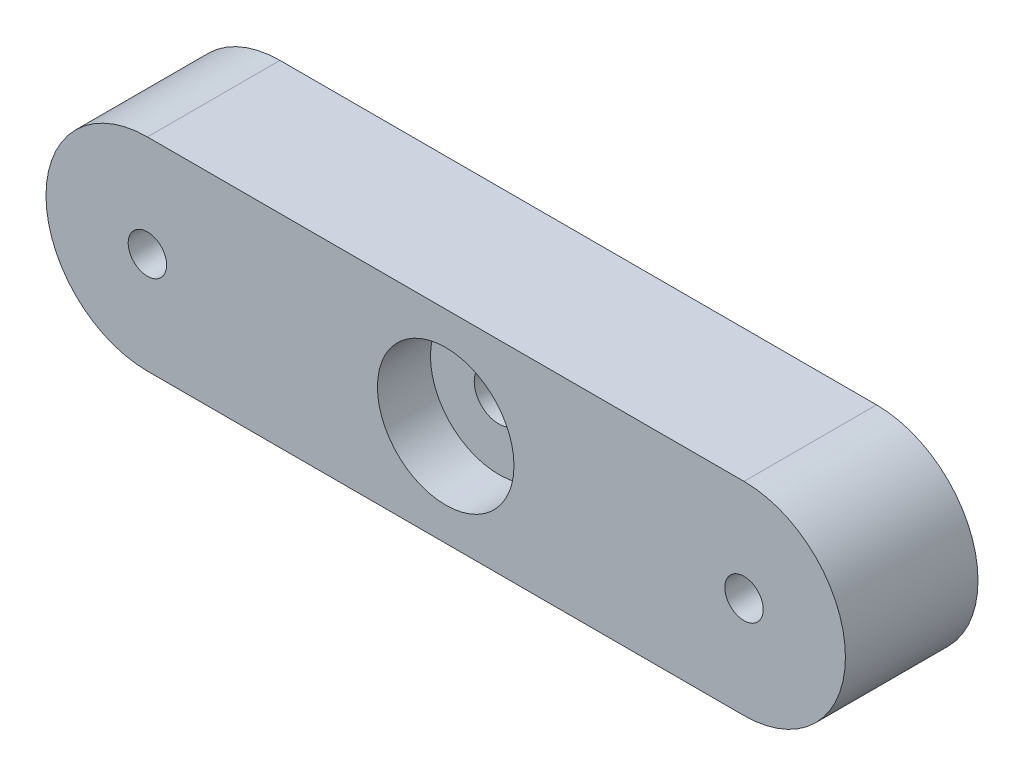
from build123d import *

# Parameters (mm, degrees)
SKETCH_1_R      = 1.45
SKETCH_1_R_2    = 5.15
EXTRUDE_1_DEPTH = 10
SKETCH_2_R      = 5.305373799
SKETCH_2_R_2    = 1.85
EXTRUDE_2_DEPTH = 6


with BuildPart() as part:
    # Эскиз1 → Бобышка-Вытянуть1 (new body)
    with BuildSketch(Plane.XY):
        with BuildLine():
            Line((0, 7.65), (45, 7.65))
            ThreePointArc((45, 7.65), (52.65, 0), (45, -7.65))
            Line((45, -7.65), (0, -7.65))
            ThreePointArc((0, -7.65), (-7.65, 0), (0, 7.65))
        make_face()
        Circle(SKETCH_1_R, mode=Mode.SUBTRACT)
        with Locations((45, 0)):
            Circle(SKETCH_1_R, mode=Mode.SUBTRACT)
        with Locations((22.5, 0)):
            Circle(SKETCH_1_R_2, mode=Mode.SUBTRACT)
    extrude(amount=EXTRUDE_1_DEPTH)

    # Эскиз2 → Бобышка-Вытянуть2 (add)
    with BuildSketch(Plane(origin=(0, 0, 0), x_dir=(-1, 0, 0), z_dir=(0, 0, -1))):
        with Locations((-22.5, 0)):
            Circle(SKETCH_2_R)
        with Locations((-22.5, 0)):
            Circle(SKETCH_2_R_2, mode=Mode.SUBTRACT)
    extrude(amount=-EXTRUDE_2_DEPTH)


solid = part.part
